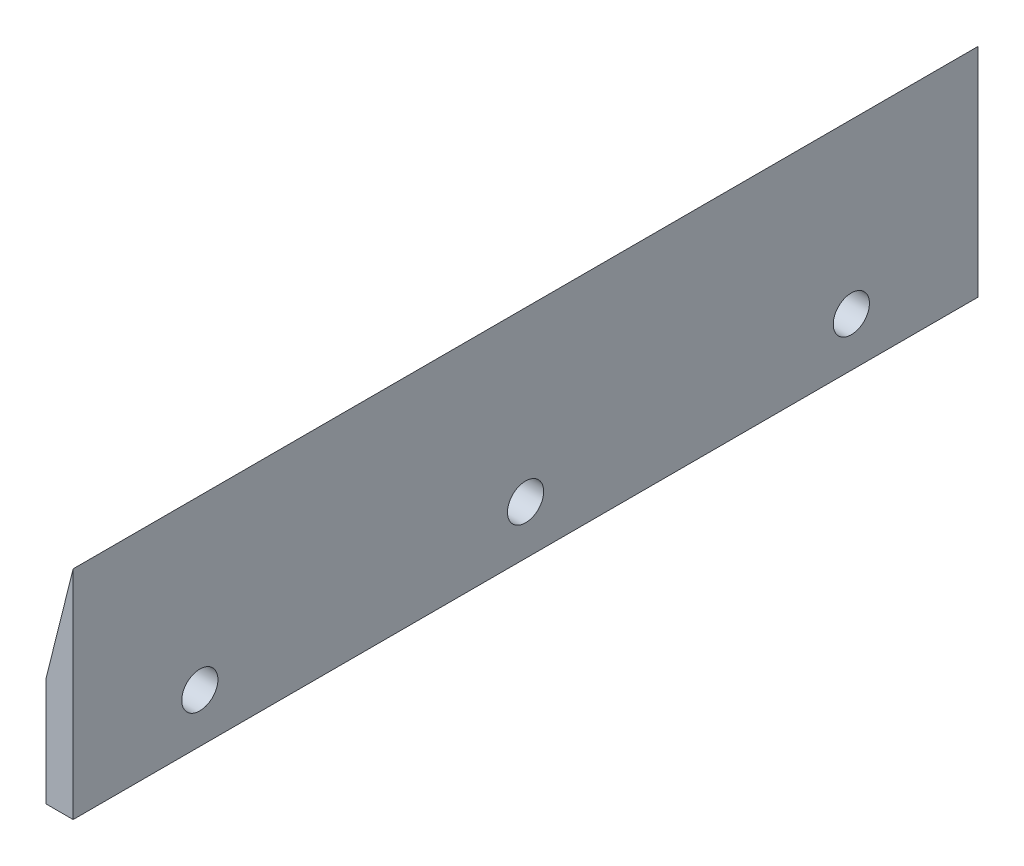
from build123d import *

# Parameters (mm, degrees)
EXTRUDE_1_DEPTH     = 250
SKETCH_2_R          = 5
CUT_EXTRUDE_1_DEPTH = 345.941923572


with BuildPart() as part:
    # 草圖1 → 填料-伸長1 (new body)
    with BuildSketch(Plane.XY):
        Polygon((-5.019605957, 177.547217701), (-12.519605957, 177.547217701), (-12.519605957, 207.547217701), (-5.019605957, 237.547217701), align=None)
    extrude(amount=EXTRUDE_1_DEPTH)

    # 草圖2 → 除料-伸長1 (cut, through all)
    with BuildSketch(Plane(origin=(-12.519605957, 0, 0), x_dir=(0, 0, -1), z_dir=(1, 0, 0))):
        with Locations((-215, 191.066951459)):
            Circle(SKETCH_2_R)
        with Locations((-125, 191.066951459)):
            Circle(SKETCH_2_R)
        with Locations((-35, 191.066951459)):
            Circle(SKETCH_2_R)
    extrude(amount=CUT_EXTRUDE_1_DEPTH, mode=Mode.SUBTRACT)


solid = part.part
